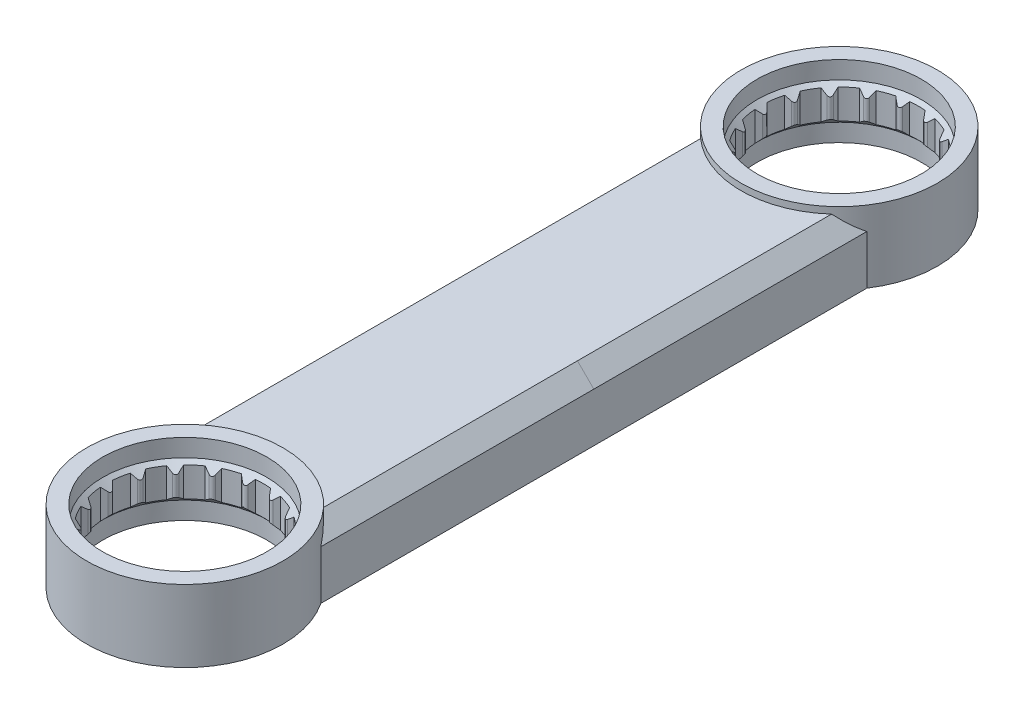
from build123d import *
from build123d.topology import SkipClean

# Parameters (mm, degrees)
BOSS_EXTRUDE1_DEPTH = 20
CHAMFER1_SIZE       = 5
SKETCH6_R           = 30
BOSS_EXTRUDE2_DEPTH = 2
SKETCH7_R           = 25.1
CUT_EXTRUDE1_DEPTH  = 136.218341951
BOSS_EXTRUDE3_DEPTH = 10.8
CIRPATTERN1_COUNT   = 18


# Read off the part's stored shape, not the designer's step: Mirror1
with BuildPart() as part:
    # Sketch5 → Boss-Extrude1 (new body)
    with BuildSketch(Plane(origin=(0, 0, 0), x_dir=(1, 0, 0), z_dir=(0, 1, 0))):
        with BuildLine():
            Line((-25, 0), (25, 0))
            Line((25, 0), (25, 83.416876048))
            ThreePointArc((25, 83.416876048), (0, 130), (-25, 83.416876048))
            Line((-25, 83.416876048), (-25, 0))
        make_face()
    extrude(amount=BOSS_EXTRUDE1_DEPTH)

    # Chamfer1
    chamfer1_edges = [part.edges().sort_by_distance(p)[0] for p in [
        (-25, 20, -41.708438024),
        (25, 20, -41.708438024),
    ]]
    chamfer(chamfer1_edges, length=CHAMFER1_SIZE)

    # Sketch6 → Boss-Extrude2 (add)
    with BuildSketch(Plane(origin=(0, 20, 0), x_dir=(1, 0, 0), z_dir=(0, 1, 0))):
        with Locations(Location((0, 100, 0), (0, 0, 213.557309762))):
            Circle(SKETCH6_R)
    extrude(amount=BOSS_EXTRUDE2_DEPTH)

    # Sketch7 → Cut-Extrude1 (cut, through all)
    with BuildSketch(Plane(origin=(0, 22, 0), x_dir=(1, 0, 0), z_dir=(0, 1, 0))):
        with Locations(Location((0, 100, 0), (0, 0, 270))):
            Circle(SKETCH7_R)
    extrude(amount=-CUT_EXTRUDE1_DEPTH, mode=Mode.SUBTRACT)

    # Sketch8 → Boss-Extrude3 (add)
    with BuildSketch(Plane(origin=(0, 5.4, 0), x_dir=(1, 0, 0), z_dir=(0, 1, 0))):
        with BuildLine():
            Line((22.792893219, 100.707106781), (29.15516832, 107.069381883))
            ThreePointArc((29.15516832, 107.069381883), (30, 100), (29.15516832, 92.930618117))
            Line((29.15516832, 92.930618117), (22.792893219, 99.292893219))
            ThreePointArc((22.792893219, 99.292893219), (22.5, 100), (22.792893219, 100.707106781))
        make_face()
    boss_extrude3 = extrude(amount=BOSS_EXTRUDE3_DEPTH)

    # Sketch9 → Cut-Revolve1 (revolve, cut)
    with BuildSketch(Plane.XY.offset(-100), mode=Mode.PRIVATE) as cut_revolve1_sk:
        Polygon((25.1, 16.6), (22.5, 14), (22.5, 8), (25.1, 5.4), (0, 5.4), (0, 16.6), align=None)
    cut_revolve1 = revolve(cut_revolve1_sk.sketch.rotate(Axis((0, 5.4, -100), (0, 1, 0)), 213.557309762), axis=Axis((0, 5.4, -100), (0, 1, 0)), mode=Mode.SUBTRACT)

    # CirPattern1: Boss-Extrude3, Cut-Revolve1 ×18 about axis
    cirpattern1_axis = Axis((0, 0, -100), (0, 1, 0))
    add([boss_extrude3.rotate(cirpattern1_axis, i * 360 / CIRPATTERN1_COUNT) for i in range(1, CIRPATTERN1_COUNT)])
    add([cut_revolve1.rotate(cirpattern1_axis, i * 360 / CIRPATTERN1_COUNT) for i in range(1, CIRPATTERN1_COUNT)], mode=Mode.SUBTRACT)

    # Sketch10 → Revolve1 (revolve)
    with SkipClean():  # the faces are left unmerged after this step: merging them gives an invalid solid
        with BuildSketch(Plane.XY.offset(-100), mode=Mode.PRIVATE) as revolve1_sk:
            Polygon((25.1, 16.6), (25.1, 5.4), (24, 6.5), (24, 15.5), align=None)
        revolve(revolve1_sk.sketch.rotate(Axis((0, 26.057051877, -100), (0, -1, 0)), 90), axis=Axis((0, 26.057051877, -100), (0, -1, 0)))

    # Mirror1: part across plane


with BuildPart() as part_1:
    with SkipClean():  # the faces are left unmerged after this step: merging them gives an invalid solid
        add(part.part)
        add(part.part.mirror(Plane(origin=(-25, 20, 0), x_dir=(1, 0, 0), z_dir=(0, 0, -1))))


solid = part_1.part
